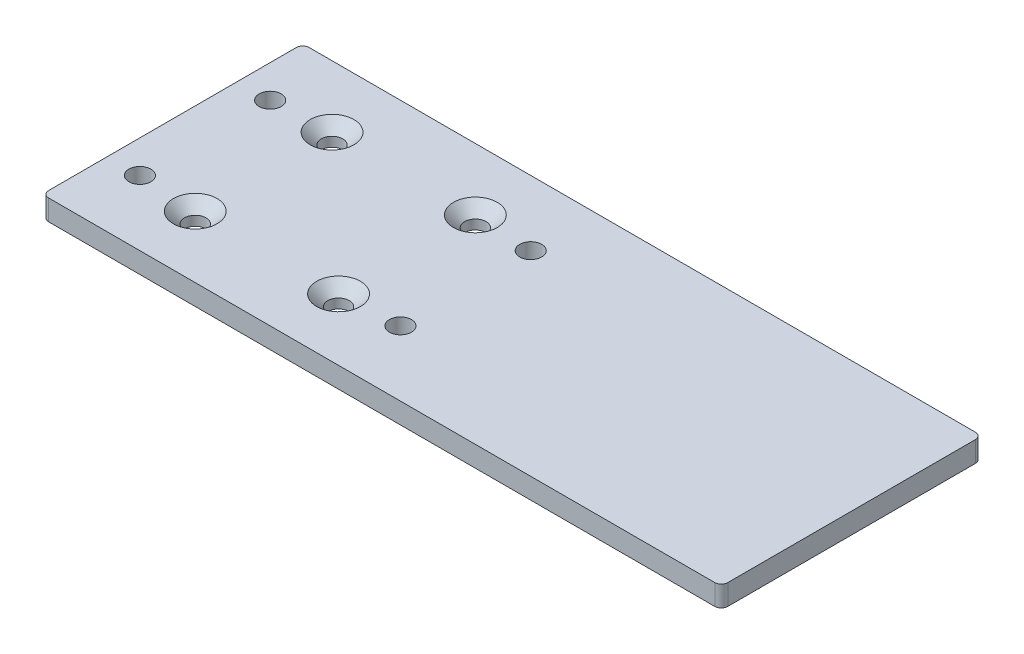
from build123d import *

# Parameters (mm, degrees)
CROQUIS1_W                                   = 208.5
CROQUIS1_H                                   = 80
BRIDA_BASE1_DEPTH                            = 6.35
REDONDEO1_R                                  = 2
TALADRO_DE_MARGEN_PARA_1_41_D                = 6.7564
REFRENTADO_PARA_TORNILLO_TAP_N_CON_C_2_COUNT = 2
REFRENTADO_PARA_TORNILLO_TAP_N_CON_C_2_PITCH = 44
REFRENTADO_PARA_TORNILLO_TAP_N_CON_C_3_COUNT = 2
REFRENTADO_PARA_TORNILLO_TAP_N_CON_C_3_PITCH = 60.827625303
REFRENTADO_PARA_TORNILLO_TAP_N_CON_C_4_COUNT = 2
REFRENTADO_PARA_TORNILLO_TAP_N_CON_C_4_PITCH = 42


# Sheet-metal steps are written as plain solids
with BuildPart() as part:
    # Croquis1 → Brida base1 (new body)
    with BuildSketch(Plane(origin=(0, 0, 0), x_dir=(1, 0, 0), z_dir=(0, 1, 0))):
        with Locations((-45.527777778, -5.555555556)):
            Rectangle(CROQUIS1_W, CROQUIS1_H)
    extrude(amount=-BRIDA_BASE1_DEPTH)

    # Redondeo1
    redondeo1_edges = [part.edges().sort_by_distance(p)[0] for p in [
        (-149.777777778, -3.175, -34.444444444),
        (58.722222222, -3.175, -34.444444444),
        (58.722222222, -3.175, 45.555555556),
        (-149.777777778, -3.175, 45.555555556),
    ]]
    fillet(redondeo1_edges, radius=REDONDEO1_R)

    # Taladro de margen para 1/41 (through all)
    with Locations(Plane(origin=(0, 0, 0), x_dir=(1, 0, 0), z_dir=(0, 1, 0))):
        with Locations((-139.777777778, -25.555555556), (-59.777777778, -25.555555556), (-139.777777778, 14.444444444), (-59.777777778, 14.444444444)):
            Hole(TALADRO_DE_MARGEN_PARA_1_41_D / 2)

    # Croquis9 → Refrentado para tornillo tapón con cabeza plana de clavija de M61 (revolve, cut)
    with BuildSketch(Plane(origin=(-121.777777778, 0, -15.444444444), x_dir=(0, 0, 1), z_dir=(1, 0, 0))):
        Polygon((0, 0), (0, 6.35), (3.3, 6.35), (3.3, 3.42), (6.72, 0), align=None)
    refrentado_para_tornillo_tap_n_con_cabez = revolve(axis=Axis((-121.777777778, 6.35, -15.444444444), (0, -1, 0)), mode=Mode.SUBTRACT)

    # Refrentado para tornillo tap_n con c 2: Refrentado para tornillo tapón con cabeza plana de clavija de M61 ×2
    with Locations(*[(i * REFRENTADO_PARA_TORNILLO_TAP_N_CON_C_2_PITCH, 0, 0) for i in range(1, REFRENTADO_PARA_TORNILLO_TAP_N_CON_C_2_COUNT)]):
        add(refrentado_para_tornillo_tap_n_con_cabez, mode=Mode.SUBTRACT)

    # Refrentado para tornillo tap_n con c 3: Refrentado para tornillo tapón con cabeza plana de clavija de M61 ×2
    with Locations(*[Vector(0.723355544143572, 0, 0.6904757466825007) * (i * REFRENTADO_PARA_TORNILLO_TAP_N_CON_C_3_PITCH) for i in range(1, REFRENTADO_PARA_TORNILLO_TAP_N_CON_C_3_COUNT)]):
        add(refrentado_para_tornillo_tap_n_con_cabez, mode=Mode.SUBTRACT)

    # Refrentado para tornillo tap_n con c 4: Refrentado para tornillo tapón con cabeza plana de clavija de M61 ×2
    with Locations(*[(0, 0, i * REFRENTADO_PARA_TORNILLO_TAP_N_CON_C_4_PITCH) for i in range(1, REFRENTADO_PARA_TORNILLO_TAP_N_CON_C_4_COUNT)]):
        add(refrentado_para_tornillo_tap_n_con_cabez, mode=Mode.SUBTRACT)


solid = part.part
